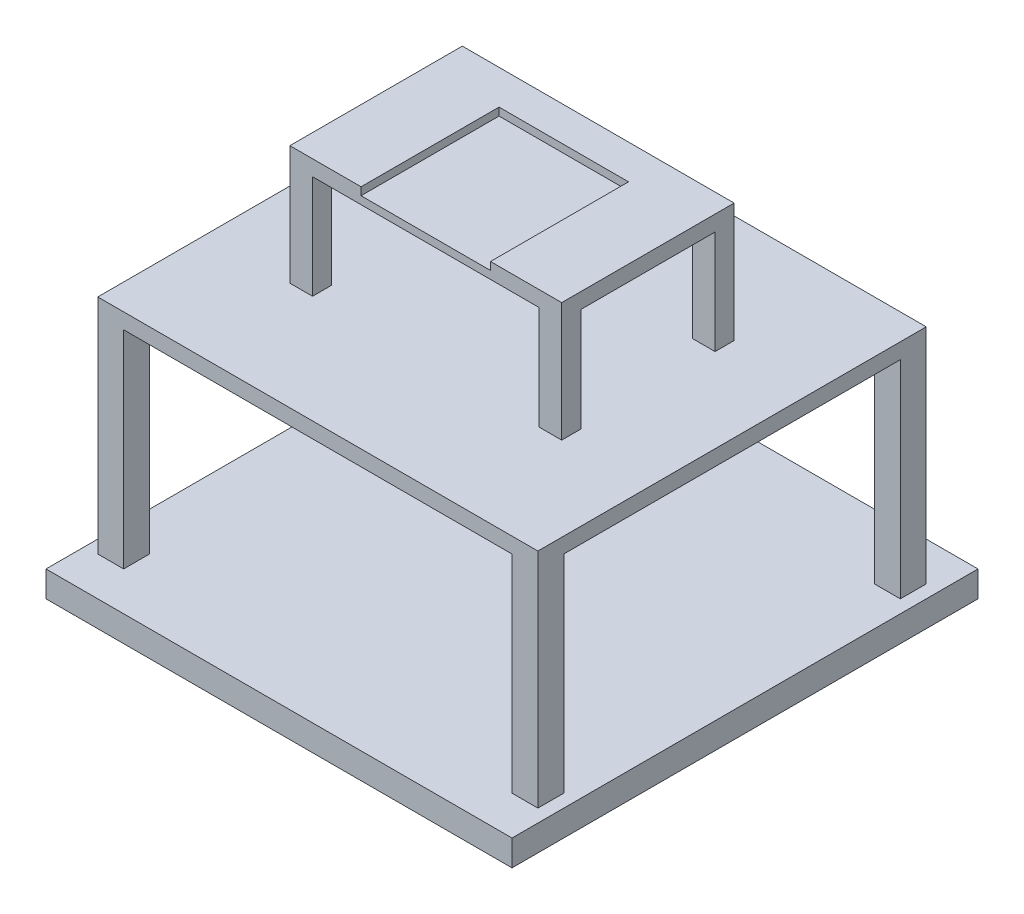
from build123d import *

# Parameters (mm, degrees)
SKETCH2_W           = 90
SKETCH2_H           = 90
BOSS_EXTRUDE2_DEPTH = 5
SKETCH4_W           = 5
SKETCH4_H           = 5
BOSS_EXTRUDE3_DEPTH = 40
SKETCH5_W           = 85
SKETCH5_H           = 75
BOSS_EXTRUDE4_DEPTH = 3
SKETCH6_W           = 4.378566542
SKETCH6_H           = 3.687740225
BOSS_EXTRUDE5_DEPTH = 20
SKETCH17_W          = 52.5
SKETCH17_H          = 33.304224278
BOSS_EXTRUDE8_DEPTH = 3
CUT_EXTRUDE6_DEPTH  = 1.5


with BuildPart() as part:
    # Sketch2 → Boss-Extrude2 (new body)
    with BuildSketch(Plane(origin=(0, 0, 0), x_dir=(1, 0, 0), z_dir=(0, 1, 0))):
        with Locations((-45, 45)):
            Rectangle(SKETCH2_W, SKETCH2_H)
    extrude(amount=BOSS_EXTRUDE2_DEPTH)

    # Sketch4 → Boss-Extrude3 (add)
    with BuildSketch(Plane(origin=(0, 5, 0), x_dir=(1, 0, 0), z_dir=(0, 1, 0))):
        with Locations((-85, 80)):
            Rectangle(SKETCH4_W, SKETCH4_H)
        with Locations((-5, 80)):
            Rectangle(SKETCH4_W, SKETCH4_H)
        with Locations((-85, 10)):
            Rectangle(SKETCH4_W, SKETCH4_H)
        with Locations((-5, 10)):
            Rectangle(SKETCH4_W, SKETCH4_H)
    extrude(amount=BOSS_EXTRUDE3_DEPTH)

    # Sketch5 → Boss-Extrude4 (add)
    with BuildSketch(Plane(origin=(0, 45, 0), x_dir=(1, 0, 0), z_dir=(0, 1, 0))):
        with Locations((-45, 45)):
            Rectangle(SKETCH5_W, SKETCH5_H)
    extrude(amount=BOSS_EXTRUDE4_DEPTH)

    # Sketch6 → Boss-Extrude5 (add)
    with BuildSketch(Plane(origin=(0, 48, 0), x_dir=(1, 0, 0), z_dir=(0, 1, 0))):
        with Locations((-69.060716729, 59.808242027)):
            Rectangle(SKETCH6_W, SKETCH6_H)
        with Locations((-20.939283271, 59.808242027)):
            Rectangle(SKETCH6_W, SKETCH6_H)
        with Locations((-20.939283271, 30.191757974)):
            Rectangle(SKETCH6_W, SKETCH6_H)
        with Locations((-69.060716729, 30.191757974)):
            Rectangle(SKETCH6_W, SKETCH6_H)
    extrude(amount=BOSS_EXTRUDE5_DEPTH)

    # Sketch17 → Boss-Extrude8 (add)
    with BuildSketch(Plane(origin=(0, 68, 0), x_dir=(1, 0, 0), z_dir=(0, 1, 0))):
        with Locations((-45, 45)):
            Rectangle(SKETCH17_W, SKETCH17_H)
    extrude(amount=BOSS_EXTRUDE8_DEPTH)

    # Sketch18 → Cut-Extrude6 (cut)
    with BuildSketch(Plane(origin=(0, 71, 0), x_dir=(1, 0, 0), z_dir=(0, 1, 0))):
        Polygon((-57.5, 35), (-57.5, 28.347887861), (-32.5, 28.347887861), (-32.5, 35), (-32.5, 55), (-57.5, 55), align=None)
    extrude(amount=-CUT_EXTRUDE6_DEPTH, mode=Mode.SUBTRACT)


solid = part.part
